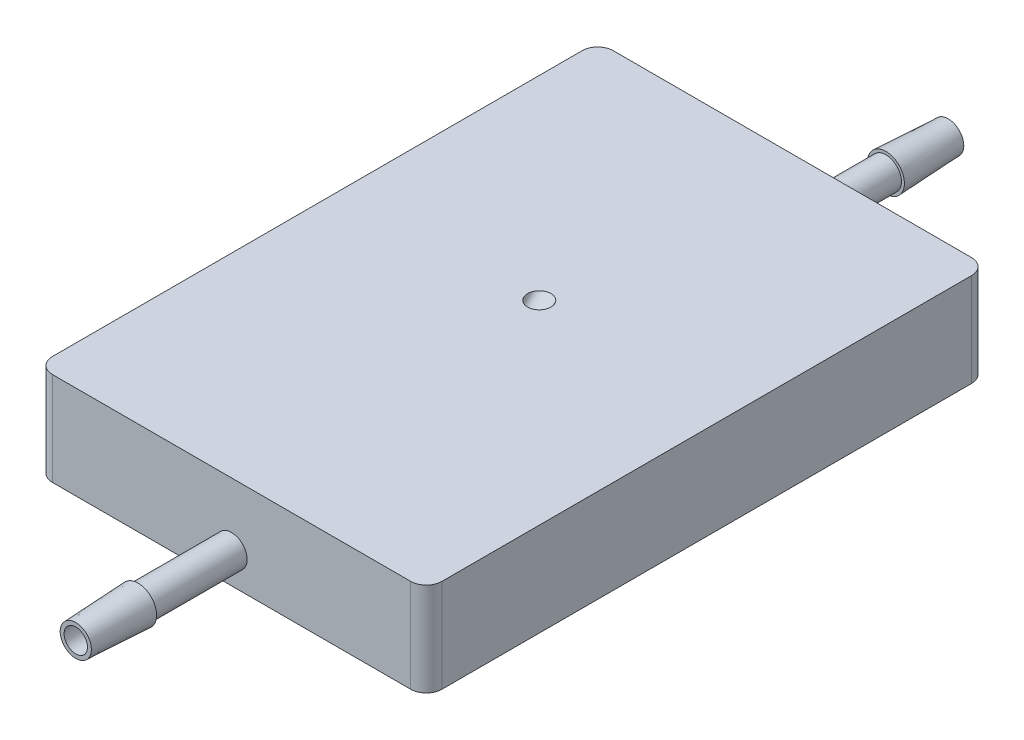
from build123d import *

# Parameters (mm, degrees)
PLATFORM_W                   = 50
PLATFORM_H                   = 72
PLATFORM_W_2                 = 22.5
PLATFORM_H_2                 = 43
PLATFORM_HEIGHT_DEPTH        = 12
TUBE_INNER_DIAMETER_SKETCH_R = 1.5
FILLET1_R                    = 2
OUTER_DIAMETER_OF_LUMEN_1_R  = 2
TUBING_SIDE_1_DEPTH          = 20
OUTER_DIAMETER_OF_LUMEN_2_R  = 2
TUBING_SIDE_2_DEPTH          = 20
ADAPTER_1_SKETCH_R           = 2.375
LUMEN_INNER_DIAMETER_R       = 1.5
HOLLOWING_OUT_LUMEN_DEPTH    = 116.381974426


with BuildPart() as part:
    # Platform → Platform Height (new body)
    # profile 1 of 2: a face of its own
    with BuildSketch(Plane(origin=(0, 0, 0), x_dir=(1, 0, 0), z_dir=(0, 1, 0))):
        Rectangle(PLATFORM_W, PLATFORM_H)
        Rectangle(PLATFORM_W_2, PLATFORM_H_2, mode=Mode.SUBTRACT)
    # profile 2 of 2: a face of its own
    with BuildSketch(Plane(origin=(0, 0, 0), x_dir=(1, 0, 0), z_dir=(0, 1, 0))):
        Rectangle(PLATFORM_W_2, PLATFORM_H_2)
    extrude(amount=-PLATFORM_HEIGHT_DEPTH)

    # Tube Inner Diameter: sweep along a curve in space
    with BuildLine() as tube_inner_diameter_path:
        Line((0, 0, -3.5), (0, -7.071067812, 3.571067812))
    # Tube Inner Diameter Sketch → Tube Inner Diameter (sweep, cut)
    with BuildSketch(Plane(origin=(0, 0, 0), x_dir=(-1, 0, 0), z_dir=(0, -1, 0))):
        with Locations((0, 3.5)):
            Circle(TUBE_INNER_DIAMETER_SKETCH_R)
    sweep(path=tube_inner_diameter_path.line, mode=Mode.SUBTRACT)

    # Fillet1
    fillet1_edges = [part.edges().sort_by_distance(p)[0] for p in [
        (25, -6, 36),
        (-25, -6, 36),
        (-25, -6, -36),
        (25, -6, -36),
    ]]
    fillet(fillet1_edges, radius=FILLET1_R)

    # Outer Diameter of Lumen 2 → Tubing Side 2 (add)
    with BuildSketch(Plane(origin=(0, 0, -36), x_dir=(-1, 0, 0), z_dir=(0, 0, -1))):
        with Locations(Location((0, -8.07, 0), (0, 0, 180))):
            Circle(OUTER_DIAMETER_OF_LUMEN_2_R)
    extrude(amount=TUBING_SIDE_2_DEPTH)

    # Adapter #2: read off the stored shape, not the designer's step
    # Adapter #2: loft between two sections, ruled curve by curve
    adapter_2_from = [
        Edge.make_bspline([(-0.156573295, -5.700166714, -48), (4.583093277, -5.387020124, -48), (4.896239867, -10.126686696, -48), (0.156573295, -10.439833286, -48), (-4.583093277, -10.752979876, -48), (-4.896239867, -6.013313304, -48), (-0.156573295, -5.700166714, -48)], [0, 0, 0, 0, 0.5, 0.5, 0.5, 1, 1, 1, 1], 3, [1, 0.333333333, 0.333333333, 1, 0.333333333, 0.333333333, 1]),
    ]
    adapter_2_to = [
        Edge.make_bspline([(-0.756069385, -6.218417141, -56), (2.947096334, -4.706278371, -56), (4.459235104, -8.40944409, -56), (0.756069385, -9.921582859, -56), (-2.947096334, -11.433721629, -56), (-4.459235104, -7.73055591, -56), (-0.756069385, -6.218417141, -56)], [0, 0, 0, 0, 0.5, 0.5, 0.5, 1, 1, 1, 1], 3, [1, 0.333333333, 0.333333333, 1, 0.333333333, 0.333333333, 1]),
    ]
    adapter_2 = Solid(Shell([*[Face.make_surface_from_curves(adapter_2_from[k], adapter_2_to[k]) for k in range(1)], Face(Wire(adapter_2_from)), Face(Wire(adapter_2_to))]))
    add(adapter_2)


with BuildPart() as body_2:
    # Outer Diameter of Lumen 1 → Tubing Side 1 (new body)
    with BuildSketch(Plane.XY.offset(36)):
        with Locations((0, -8.07)):
            Circle(OUTER_DIAMETER_OF_LUMEN_1_R)
    extrude(amount=TUBING_SIDE_1_DEPTH)

    # Adapter #1 Sketch → section 0 of adapter_1
    with BuildSketch(Plane.XY.offset(48), mode=Mode.PRIVATE) as adapter_1_s0:
        with Locations((0, -8.07)):
            Circle(ADAPTER_1_SKETCH_R)
    # loft up to a face of the part (adapter_1)
    loft([adapter_1_s0.sketch, Face(Wire([body_2.edges().sort_by_distance((-1.369094212, -6.612062745, 56))[0]]))])


with BuildPart() as hollowing_out_lumen_tool:
    # Lumen Inner Diameter → Hollowing Out Lumen (new, through all)
    with BuildSketch(Plane.XY.offset(56)):
        with Locations((0, -8.07)):
            Circle(LUMEN_INNER_DIAMETER_R)
    extrude(amount=-HOLLOWING_OUT_LUMEN_DEPTH)


with BuildPart() as part_1:
    add(part.part)

    # Hollowing Out Lumen: cut by hollowing_out_lumen_tool
    add(hollowing_out_lumen_tool.part, mode=Mode.SUBTRACT)


with BuildPart() as body_2_1:
    add(body_2.part)

    # Hollowing Out Lumen: cut by hollowing_out_lumen_tool
    add(hollowing_out_lumen_tool.part, mode=Mode.SUBTRACT)


solid = Compound([part_1.part, body_2_1.part])
